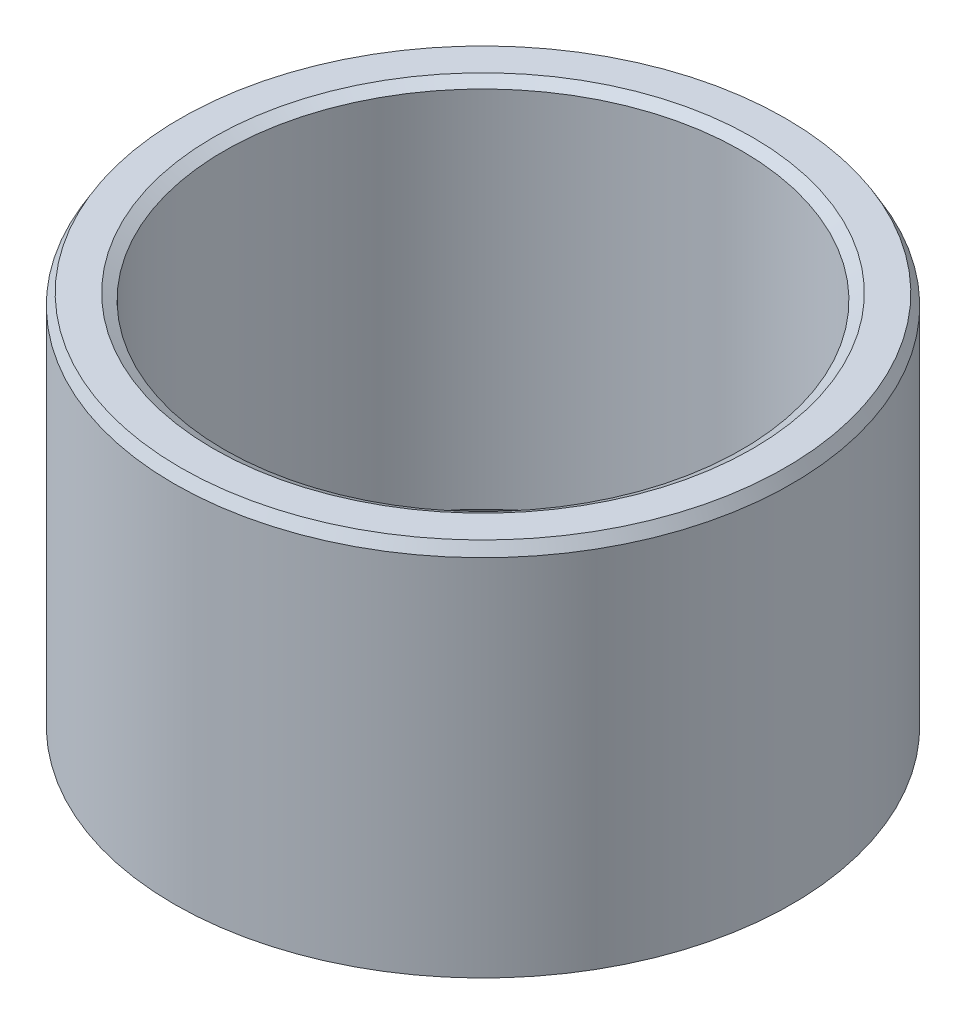
from build123d import *
from OCP.BRepFilletAPI import BRepFilletAPI_MakeChamfer

# Parameters (mm, degrees)
SKETCH1_R           = 37.5
BOSS_EXTRUDE1_DEPTH = 46.287906713
SKETCH2_R           = 31.422303499
CUT_EXTRUDE1_DEPTH  = 71.392260284
CHAMFER1_SIZE       = 1.322967308
CHAMFER1_SIZE2      = 0.763815531


with BuildPart() as part:
    # Sketch1 → Boss-Extrude1 (new body)
    with BuildSketch(Plane(origin=(0, 0, 0), x_dir=(1, 0, 0), z_dir=(0, 1, 0))):
        Circle(SKETCH1_R)
    extrude(amount=BOSS_EXTRUDE1_DEPTH)

    # Sketch2 → Cut-Extrude1 (cut, through all)
    with BuildSketch(Plane(origin=(0, 0, 0), x_dir=(1, 0, 0), z_dir=(0, 1, 0))):
        Circle(SKETCH2_R)
    extrude(amount=CUT_EXTRUDE1_DEPTH, mode=Mode.SUBTRACT)

    # Chamfer1: one chamfer whose edges measure the first distance from different faces: ONE call of the kernel's chamfer builder (chamfer() names one face for all edges)
    chamfer1_edges_1 = [part.edges().sort_by_distance(p)[0] for p in [
        (-31.422303499, 46.287906713, 0),
    ]]
    chamfer1_side_1 = [part.faces().sort_by_distance(p)[0] for p in [
        (-36.439339828, 46.287906713, 0),
    ]]
    chamfer1_edges_2 = [part.edges().sort_by_distance(p)[0] for p in [
        (-31.422303499, 0, 0),
    ]]
    chamfer1_side_2 = [part.faces().sort_by_distance(p)[0] for p in [
        (-31.422303499, 23.143953357, 0),
    ]]
    chamfer1_edges_3 = [part.edges().sort_by_distance(p)[0] for p in [
        (-37.5, 0, 0),
    ]]
    chamfer1_side_3 = [part.faces().sort_by_distance(p)[0] for p in [
        (-36.439339828, 0, 0),
    ]]
    chamfer1_edges_4 = [part.edges().sort_by_distance(p)[0] for p in [
        (-37.5, 46.287906713, 0),
    ]]
    chamfer1_side_4 = [part.faces().sort_by_distance(p)[0] for p in [
        (-37.5, 23.143953357, 0),
    ]]
    chamfer1 = BRepFilletAPI_MakeChamfer(part.part.solid().wrapped)
    for e in chamfer1_edges_1:
        chamfer1.Add(CHAMFER1_SIZE, CHAMFER1_SIZE2, e.wrapped, chamfer1_side_1[0].wrapped)  # the first distance lies on this face
    for e in chamfer1_edges_2:
        chamfer1.Add(CHAMFER1_SIZE, CHAMFER1_SIZE2, e.wrapped, chamfer1_side_2[0].wrapped)  # the first distance lies on this face
    for e in chamfer1_edges_3:
        chamfer1.Add(CHAMFER1_SIZE, CHAMFER1_SIZE2, e.wrapped, chamfer1_side_3[0].wrapped)  # the first distance lies on this face
    for e in chamfer1_edges_4:
        chamfer1.Add(CHAMFER1_SIZE, CHAMFER1_SIZE2, e.wrapped, chamfer1_side_4[0].wrapped)  # the first distance lies on this face
    add(Compound.cast(chamfer1.Shape()), mode=Mode.REPLACE)


solid = part.part
